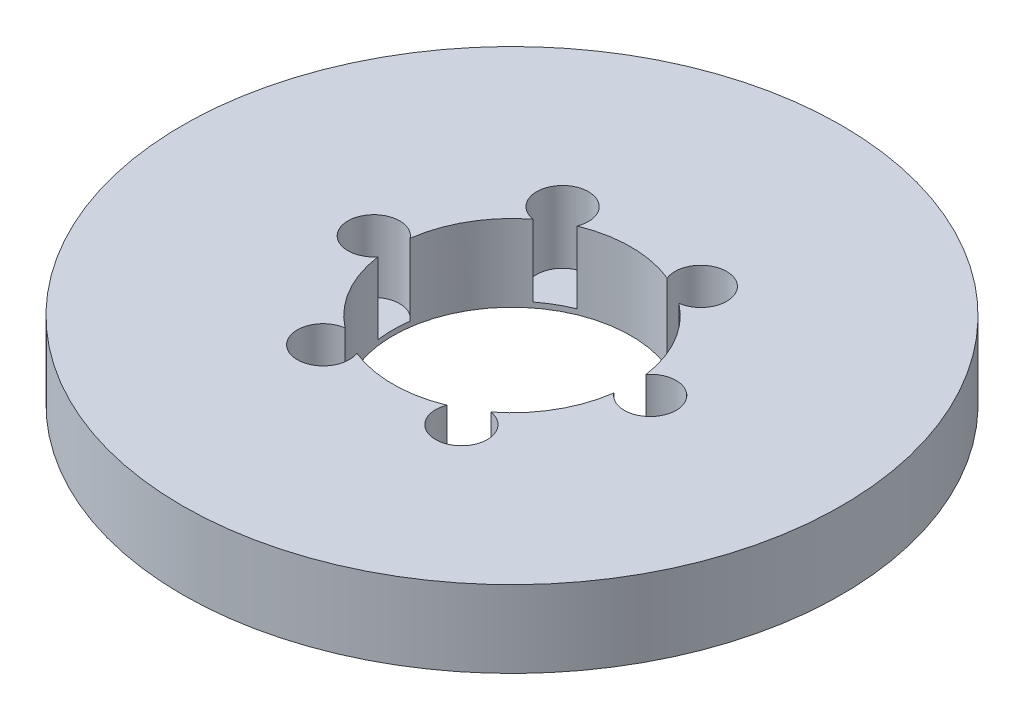
from build123d import *

# Parameters (mm, degrees)
SKETCH1_R           = 90
BOSS_EXTRUDE1_DEPTH = 21
SKETCH2_R           = 32.5
CUT_EXTRUDE1_DEPTH  = 130
SKETCH3_R           = 7.075332355
CUT_EXTRUDE2_DEPTH  = 19.589849974
CIRPATTERN1_COUNT   = 6


with BuildPart() as part:
    # Sketch1 → Boss-Extrude1 (new body)
    with BuildSketch(Plane(origin=(0, 0, 0), x_dir=(1, 0, 0), z_dir=(0, 1, 0))):
        Circle(SKETCH1_R)
    extrude(amount=BOSS_EXTRUDE1_DEPTH)

    # Sketch2 → Cut-Extrude1 (cut, through all)
    with BuildSketch(Plane(origin=(0, 0, 0), x_dir=(1, 0, 0), z_dir=(0, 1, 0))):
        Circle(SKETCH2_R)
    extrude(amount=CUT_EXTRUDE1_DEPTH, mode=Mode.SUBTRACT)

    # Sketch3 → Cut-Extrude2 (cut)
    with BuildSketch(Plane(origin=(0, 21, 0), x_dir=(1, 0, 0), z_dir=(0, 1, 0))):
        with Locations((-37.744139501, 0)):
            Circle(SKETCH3_R)
    cut_extrude2 = extrude(amount=-CUT_EXTRUDE2_DEPTH, mode=Mode.SUBTRACT)

    # CirPattern1: Cut-Extrude2 ×6 about axis
    cirpattern1_axis = Axis((0, 0, 0), (0, 1, 0))
    for i in range(1, CIRPATTERN1_COUNT):
        add(cut_extrude2.rotate(cirpattern1_axis, i * 360 / CIRPATTERN1_COUNT), mode=Mode.SUBTRACT)


solid = part.part
